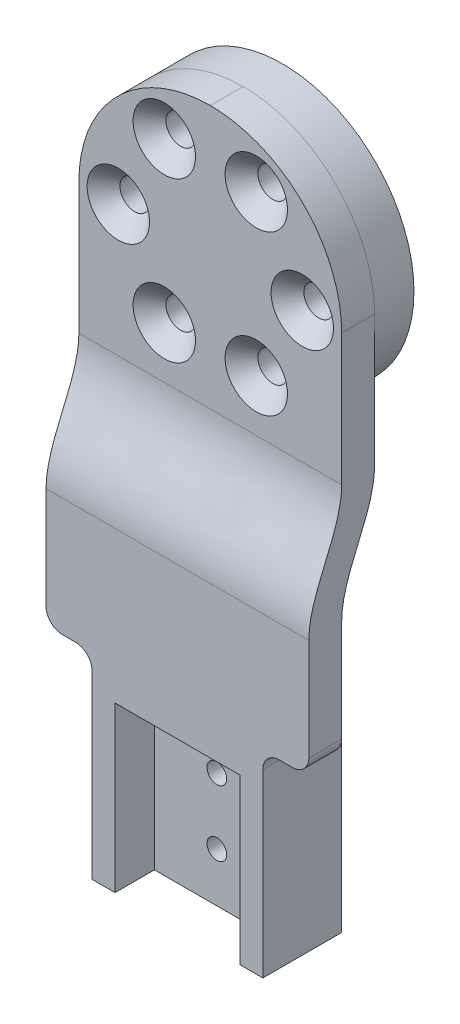
from build123d import *

# Parameters (mm, degrees)
SKETCH7_W           = 40
SKETCH7_H           = 40
BOSS_EXTRUDE1_DEPTH = 11
LOFT1_START         = -20
LOFT1_DEPTH         = 40
SKETCH16_W          = 49.026286786
SKETCH16_H          = 65.242270374
SKETCH16_R          = 20
CUT_EXTRUDE3_DEPTH  = 6
SKETCH17_W          = 40
SKETCH17_H          = 5
BOSS_EXTRUDE5_DEPTH = 18
SKETCH10_R          = 2.25
CUT_EXTRUDE1_DEPTH  = 25
CHAMFER1_SIZE       = 2.5
FILLET3_R           = 20
SKETCH11_W          = 26
SKETCH11_H          = 12
BOSS_EXTRUDE6_DEPTH = 30
SKETCH21_W          = 19
SKETCH21_H          = 6
CUT_EXTRUDE4_DEPTH  = 25
FILLET5_R           = 2.5
FILLET7_R           = 2.5
SKETCH22_R          = 1.5
CUT_EXTRUDE5_DEPTH  = 12.5


# Read off the part's stored shape, not the designer's step: Loft1
with BuildPart() as part:
    # Sketch7 → Boss-Extrude1 (new body)
    with BuildSketch(Plane.XY):
        Rectangle(SKETCH7_W, SKETCH7_H)
    extrude(amount=BOSS_EXTRUDE1_DEPTH)

    # Loft1 outline → Loft1 (add)
    with BuildSketch(Plane.YZ.offset(LOFT1_START)):
        with BuildLine():
            add(Edge.make_bspline(
                [(-38, 16), (-31.772819436, 16), (-26.227180564, 11), (-20, 11)],
                knots=[0, 0, 0, 0, 1, 1, 1, 1], degree=3))
            Line((-38, 16), (-38, 11))
            add(Edge.make_bspline(
                [(-38, 11), (-31.772819436, 11), (-26.227180564, 6), (-20, 6)],
                knots=[0, 0, 0, 0, 1, 1, 1, 1], degree=3))
            Line((-20, 6), (-20, 11))
        make_face()
    extrude(amount=LOFT1_DEPTH)

    # Sketch16 → Cut-Extrude3 (cut)
    with BuildSketch(Plane(origin=(0, 0, 0), x_dir=(-1, 0, 0), z_dir=(0, 0, -1))):
        Rectangle(SKETCH16_W, SKETCH16_H)
        Circle(SKETCH16_R, mode=Mode.SUBTRACT)
    extrude(amount=-CUT_EXTRUDE3_DEPTH, mode=Mode.SUBTRACT)

    # Sketch17 → Boss-Extrude5 (add)
    with BuildSketch(Plane(origin=(0, -38, 0), x_dir=(-1, 0, 0), z_dir=(0, -1, 0))):
        with Locations((0, -13.5)):
            Rectangle(SKETCH17_W, SKETCH17_H)
    extrude(amount=BOSS_EXTRUDE5_DEPTH)

    # Sketch10 → Cut-Extrude1 (cut)
    with BuildSketch(Plane.XY.offset(11)):
        with Locations((-7.00009521, 12.124420806)):
            Circle(SKETCH10_R)
        with Locations((6.99990479, 12.124420806)):
            Circle(SKETCH10_R)
        with Locations((13.99990479, 6.5153e-05)):
            Circle(SKETCH10_R)
        with Locations((6.99990479, -12.1242905)):
            Circle(SKETCH10_R)
        with Locations((-7.00009521, -12.1242905)):
            Circle(SKETCH10_R)
        with Locations((-14.00009521, 6.5153e-05)):
            Circle(SKETCH10_R)
    extrude(amount=-CUT_EXTRUDE1_DEPTH, mode=Mode.SUBTRACT)

    # Chamfer1
    chamfer1_edges = [part.edges().sort_by_distance(p)[0] for p in [
        (4.74990479, 12.124420806, 11),
        (-9.25009521, 12.124420806, 11),
        (-16.25009521, 6.5153e-05, 11),
        (-9.25009521, -12.1242905, 11),
        (4.74990479, -12.1242905, 11),
        (11.74990479, 6.5153e-05, 11),
    ]]
    chamfer(chamfer1_edges, length=CHAMFER1_SIZE)

    # Fillet3
    fillet3_edges = [part.edges().sort_by_distance(p)[0] for p in [
        (20, 20, 8.5),
        (-20, 20, 8.5),
    ]]
    fillet(fillet3_edges, radius=FILLET3_R - 0.0001)  # a hair under: the kernel refuses the full size

    # Sketch11 → Boss-Extrude6 (add)
    with BuildSketch(Plane(origin=(0, -56, -3.472963553), x_dir=(1, 0, 0), z_dir=(0, 1, 0))):
        with Locations((0, -13.472963553)):
            Rectangle(SKETCH11_W, SKETCH11_H)
    extrude(amount=-BOSS_EXTRUDE6_DEPTH)

    # Sketch21 → Cut-Extrude4 (cut)
    with BuildSketch(Plane(origin=(0, -86, 0), x_dir=(-1, 0, 0), z_dir=(0, -1, 0))):
        with Locations((0, -13)):
            Rectangle(SKETCH21_W, SKETCH21_H)
    extrude(amount=-CUT_EXTRUDE4_DEPTH, mode=Mode.SUBTRACT)

    # Fillet5
    fillet5_edges = [part.edges().sort_by_distance(p)[0] for p in [
        (-13, -56, 13.5),
        (-20, -56, 13.5),
        (13, -56, 13.5),
        (20, -56, 13.5),
    ]]
    fillet(fillet5_edges, radius=FILLET5_R)

    # Fillet7
    fillet7_edges = [part.edges().sort_by_distance(p)[0] for p in [
        (0, -56, 11),
        (0, -56, 4),
    ]]
    fillet(fillet7_edges, radius=FILLET7_R)

    # Sketch22 → Cut-Extrude5 (cut, symmetric)
    with BuildSketch(Plane.XY):
        with Locations(Location((0, -68.5, 0), (0, 0, 180))):
            Circle(SKETCH22_R)
        with Locations(Location((0, -78.5, 0), (0, 0, 180))):
            Circle(SKETCH22_R)
    extrude(amount=CUT_EXTRUDE5_DEPTH, both=True, mode=Mode.SUBTRACT)


solid = part.part
